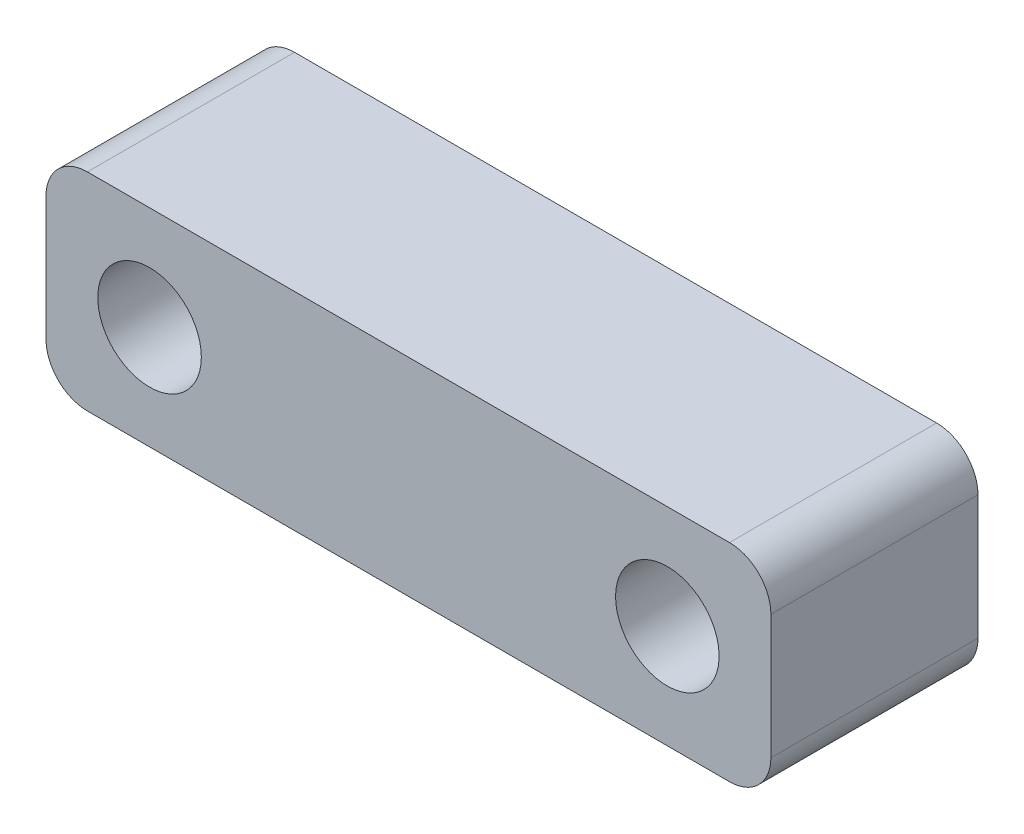
from build123d import *

# Parameters (mm, degrees)
ESQUISSE1_W        = 35
ESQUISSE1_H        = 10
ESQUISSE1_R        = 2.5
BOSS_EXTRU_1_DEPTH = 10
CONG_1_R           = 2
CONG_2_R           = 2
CONG_3_R           = 2
CONG_4_R           = 2


with BuildPart() as part:
    # Esquisse1 → Boss.-Extru.1 (new body)
    with BuildSketch(Plane.XY):
        with Locations((1.158413849, 3.369565217)):
            Rectangle(ESQUISSE1_W, ESQUISSE1_H)
        with Locations((-11.341586151, 3.369565217)):
            Circle(ESQUISSE1_R, mode=Mode.SUBTRACT)
        with Locations((13.658413849, 3.369565217)):
            Circle(ESQUISSE1_R, mode=Mode.SUBTRACT)
    extrude(amount=BOSS_EXTRU_1_DEPTH)

    # Congé1
    cong_1_edges = [part.edges().sort_by_distance(p)[0] for p in [
        (-16.341586151, 8.369565217, 5),
    ]]
    fillet(cong_1_edges, radius=CONG_1_R)

    # Congé2
    cong_2_edges = [part.edges().sort_by_distance(p)[0] for p in [
        (-16.341586151, -1.630434783, 5),
    ]]
    fillet(cong_2_edges, radius=CONG_2_R)

    # Congé3
    cong_3_edges = [part.edges().sort_by_distance(p)[0] for p in [
        (18.658413849, 8.369565217, 5),
    ]]
    fillet(cong_3_edges, radius=CONG_3_R)

    # Congé4
    cong_4_edges = [part.edges().sort_by_distance(p)[0] for p in [
        (18.658413849, -1.630434783, 5),
    ]]
    fillet(cong_4_edges, radius=CONG_4_R)


solid = part.part
